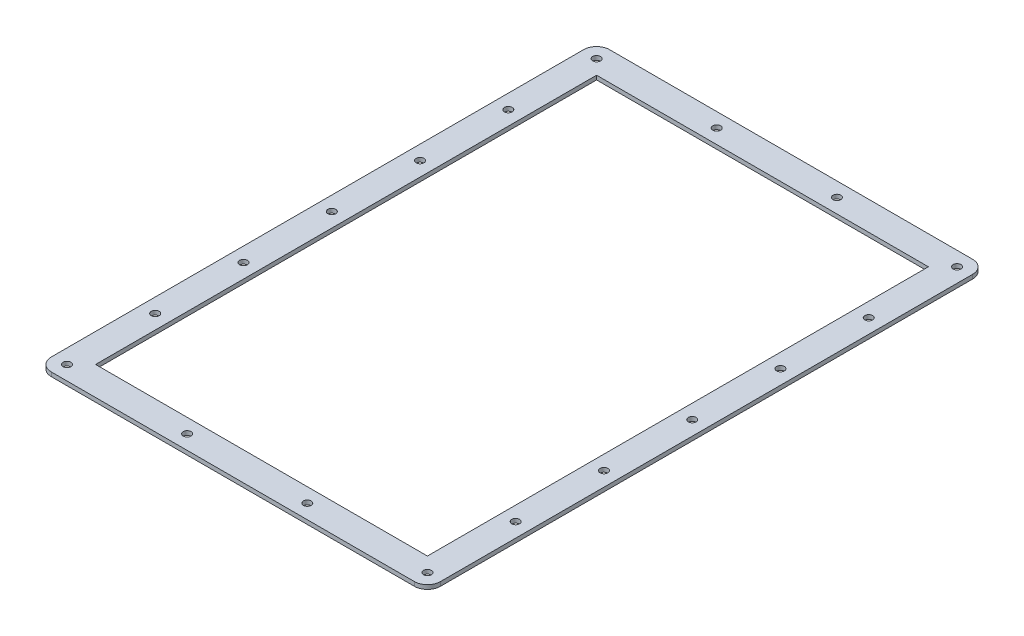
from build123d import *

# Parameters (mm, degrees)
SKETCH1_W           = 299
SKETCH1_H           = 429
SKETCH1_R           = 3
SKETCH1_W_2         = 255
SKETCH1_H_2         = 385
BOSS_EXTRUDE1_DEPTH = 3.175
FILLET1_R           = 10


with BuildPart() as part:
    # Sketch1 → Boss-Extrude1 (new body)
    with BuildSketch(Plane(origin=(0, 0, 0), x_dir=(1, 0, 0), z_dir=(0, 1, 0))):
        with Locations((2.5, -57.5)):
            Rectangle(SKETCH1_W, SKETCH1_H)
        with Locations((-136, -261)):
            Circle(SKETCH1_R, mode=Mode.SUBTRACT)
        with Locations((-136, -193.166666667)):
            Circle(SKETCH1_R, mode=Mode.SUBTRACT)
        with Locations((-43.666666667, -261)):
            Circle(SKETCH1_R, mode=Mode.SUBTRACT)
        with Locations((-136, -125.333333333)):
            Circle(SKETCH1_R, mode=Mode.SUBTRACT)
        with Locations((-136, -57.5)):
            Circle(SKETCH1_R, mode=Mode.SUBTRACT)
        with Locations((48.666666667, -261)):
            Circle(SKETCH1_R, mode=Mode.SUBTRACT)
        with Locations((141, -261)):
            Circle(SKETCH1_R, mode=Mode.SUBTRACT)
        with Locations((141, -193.166666667)):
            Circle(SKETCH1_R, mode=Mode.SUBTRACT)
        with Locations((141, -125.333333333)):
            Circle(SKETCH1_R, mode=Mode.SUBTRACT)
        with Locations((-136, 10.333333333)):
            Circle(SKETCH1_R, mode=Mode.SUBTRACT)
        with Locations((2.5, -57.5)):
            Rectangle(SKETCH1_W_2, SKETCH1_H_2, mode=Mode.SUBTRACT)
        with Locations((-136, 78.166666667)):
            Circle(SKETCH1_R, mode=Mode.SUBTRACT)
        with Locations((-136, 146)):
            Circle(SKETCH1_R, mode=Mode.SUBTRACT)
        with Locations((-43.666666667, 146)):
            Circle(SKETCH1_R, mode=Mode.SUBTRACT)
        with Locations((141, -57.5)):
            Circle(SKETCH1_R, mode=Mode.SUBTRACT)
        with Locations((141, 10.333333333)):
            Circle(SKETCH1_R, mode=Mode.SUBTRACT)
        with Locations((48.666666667, 146)):
            Circle(SKETCH1_R, mode=Mode.SUBTRACT)
        with Locations((141, 78.166666667)):
            Circle(SKETCH1_R, mode=Mode.SUBTRACT)
        with Locations((141, 146)):
            Circle(SKETCH1_R, mode=Mode.SUBTRACT)
    extrude(amount=BOSS_EXTRUDE1_DEPTH)

    # Fillet1
    fillet1_edges = [part.edges().sort_by_distance(p)[0] for p in [
        (152, 1.5875, 272),
        (-147, 1.5875, 272),
        (152, 1.5875, -157),
        (-147, 1.5875, -157),
    ]]
    fillet(fillet1_edges, radius=FILLET1_R)


solid = part.part
